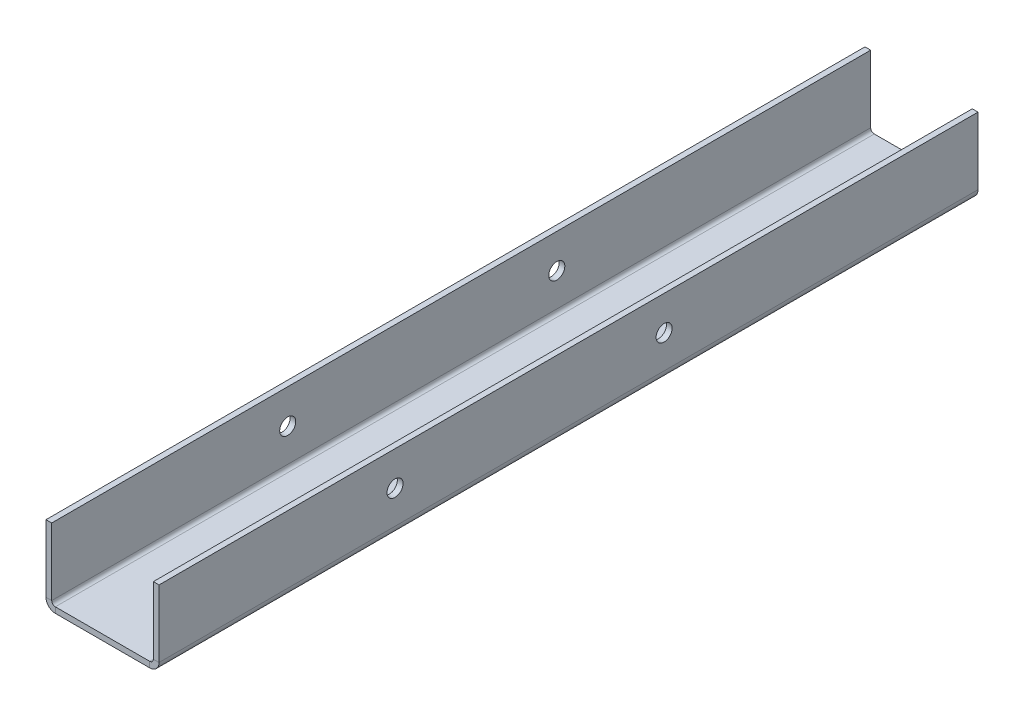
from build123d import *

# Parameters (mm, degrees)
SKETCH1_W            = 20
SKETCH1_H            = 173.5
BASE_FLANGE1_DEPTH   = 1.21
EDGE_FLANGE1_DEPTH   = 173.5
EDGE_FLANGE2_DEPTH   = 173.5
SKETCH14_R           = 1.2
CUT_EXTRUDE1_DEPTH   = 5
M3_CLEARANCE_HOLE1_D = 3.4


# Sheet-metal steps are written as plain solids
with BuildPart() as part:
    # Sketch1 → Base-Flange1 (new body)
    with BuildSketch(Plane(origin=(0, 0, 0), x_dir=(1, 0, 0), z_dir=(0, 1, 0))):
        Rectangle(SKETCH1_W, SKETCH1_H)
    extrude(amount=-BASE_FLANGE1_DEPTH)

    # Edge-Flange1 section (across the edge) → Edge-Flange1 (add)
    with BuildSketch(Plane(origin=(-10.762, 0, -86.75), x_dir=(1, 0, 0), z_dir=(0, 0, 1))):
        with BuildLine():
            Line((-1.21, 0.762), (-1.21, 15))
            Line((-1.21, 15), (0, 15))
            Line((0, 15), (0, 0.762))
            ThreePointArc((0, 0.762), (0.223184633, 0.223184633), (0.762, 0))
            Line((0.762, 0), (0.762, -1.21))
            ThreePointArc((0.762, -1.21), (-0.632414572, -0.632414572), (-1.21, 0.762))
        make_face()
    extrude(amount=EDGE_FLANGE1_DEPTH)

    # Edge-Flange2 section (across the edge) → Edge-Flange2 (add)
    with BuildSketch(Plane(origin=(10.762, 0, 86.75), x_dir=(-1, 0, 0), z_dir=(0, 0, -1))):
        with BuildLine():
            Line((-1.21, 0.762), (-1.21, 15))
            Line((-1.21, 15), (0, 15))
            Line((0, 15), (0, 0.762))
            ThreePointArc((0, 0.762), (0.223184633, 0.223184633), (0.762, 0))
            Line((0.762, 0), (0.762, -1.21))
            ThreePointArc((0.762, -1.21), (-0.632414572, -0.632414572), (-1.21, 0.762))
        make_face()
    extrude(amount=EDGE_FLANGE2_DEPTH)

    # Sketch14 → Cut-Extrude1 (cut)
    with BuildSketch(Plane(origin=(0, -1.21, 0), x_dir=(-1, 0, 0), z_dir=(0, -1, 0))):
        with Locations(Location((0, -69.75, 0), (0, 0, 90))):
            Circle(SKETCH14_R)
    extrude(amount=-CUT_EXTRUDE1_DEPTH, mode=Mode.SUBTRACT)

    # M3 Clearance Hole1 (through all)
    with Locations(Plane(origin=(-11.972, 85.70162808, 15.202320986), x_dir=(0, 0, -1), z_dir=(-1, 0, 0))):
        with Locations((-21.547679014, 77.93962808), (35.452320986, 77.93962808)):
            Hole(M3_CLEARANCE_HOLE1_D / 2)


solid = part.part
